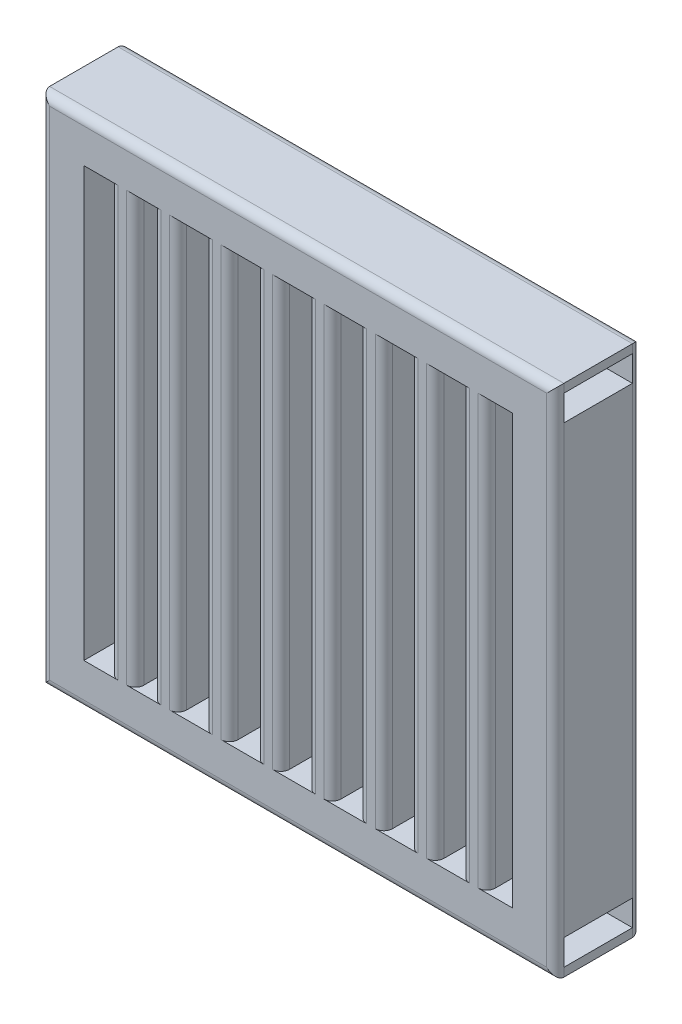
from build123d import *

# Parameters (mm, degrees)
SKETCH1_W           = 152.4
SKETCH1_H           = 152.4
BOSS_EXTRUDE1_DEPTH = 25.4
SKETCH7_W           = 20.32
SKETCH7_H           = 7.62
CUT_EXTRUDE4_DEPTH  = 25.4
SKETCH8_W           = 20.32
SKETCH8_H           = 7.62
CUT_EXTRUDE5_DEPTH  = 25.4
SKETCH9_W           = 7.62
SKETCH9_H           = 127
SKETCH9_W_2         = 5.08
CUT_EXTRUDE6_DEPTH  = 25.4
FILLET3_R           = 2.54
FILLET4_R           = 2.54
FILLET5_DEPTH       = 152.4
FILLET5_START       = -153
FILLET5_2_DEPTH     = 154
FILLET6_R           = 2.54
SKETCH11_W          = 20.32
SKETCH11_H          = 7.62
CUT_EXTRUDE8_DEPTH  = 25.4
SKETCH12_W          = 20.32
SKETCH12_H          = 7.62
CUT_EXTRUDE9_DEPTH  = 25.4


with BuildPart() as part:
    # Sketch1 → Boss-Extrude1 (new body)
    with BuildSketch(Plane.XY):
        with Locations((-76.2, 76.2)):
            Rectangle(SKETCH1_W, SKETCH1_H)
    extrude(amount=BOSS_EXTRUDE1_DEPTH)

    # Sketch7 → Cut-Extrude4 (cut)
    with BuildSketch(Plane(origin=(0, 0, 0), x_dir=(0, 0, -1), z_dir=(1, 0, 0))):
        with Locations((-12.7, 146.05)):
            Rectangle(SKETCH7_W, SKETCH7_H)
    extrude(amount=-CUT_EXTRUDE4_DEPTH, mode=Mode.SUBTRACT)

    # Sketch8 → Cut-Extrude5 (cut)
    with BuildSketch(Plane(origin=(0, 0, 0), x_dir=(0, 0, -1), z_dir=(1, 0, 0))):
        with Locations((-12.7, 6.35)):
            Rectangle(SKETCH8_W, SKETCH8_H)
    extrude(amount=-CUT_EXTRUDE5_DEPTH, mode=Mode.SUBTRACT)

    # Sketch9 → Cut-Extrude6 (cut)
    with BuildSketch(Plane.XY.offset(25.4)):
        with Locations((-135.89, 76.2)):
            Rectangle(SKETCH9_W, SKETCH9_H)
        with Locations((-121.92, 76.2)):
            Rectangle(SKETCH9_W_2, SKETCH9_H)
        with Locations((-107.95, 76.2)):
            Rectangle(SKETCH9_W, SKETCH9_H)
        with Locations((-92.71, 76.2)):
            Rectangle(SKETCH9_W, SKETCH9_H)
        with Locations((-77.47, 76.2)):
            Rectangle(SKETCH9_W, SKETCH9_H)
        with Locations((-62.23, 76.2)):
            Rectangle(SKETCH9_W, SKETCH9_H)
        with Locations((-46.99, 76.2)):
            Rectangle(SKETCH9_W, SKETCH9_H)
        with Locations((-31.75, 76.2)):
            Rectangle(SKETCH9_W, SKETCH9_H)
        with Locations((-16.51, 76.2)):
            Rectangle(SKETCH9_W, SKETCH9_H)
    extrude(amount=-CUT_EXTRUDE6_DEPTH, mode=Mode.SUBTRACT)

    # Fillet3
    fillet3_edges = [part.edges().sort_by_distance(p)[0] for p in [
        (-73.66, 76.2, 25.4),
        (-81.28, 76.2, 25.4),
        (-58.42, 76.2, 25.4),
        (-66.04, 76.2, 25.4),
        (-43.18, 76.2, 25.4),
        (-50.8, 76.2, 25.4),
        (-27.94, 76.2, 25.4),
        (-35.56, 76.2, 25.4),
        (-20.32, 76.2, 25.4),
        (-132.08, 76.2, 25.4),
        (-119.38, 76.2, 25.4),
        (-124.46, 76.2, 25.4),
        (-104.14, 76.2, 25.4),
        (-111.76, 76.2, 25.4),
        (-88.9, 76.2, 25.4),
        (-96.52, 76.2, 25.4),
    ]]
    fillet(fillet3_edges, radius=FILLET3_R)

    # Fillet4
    fillet4_edges = [part.edges().sort_by_distance(p)[0] for p in [
        (-81.28, 76.2, 0),
        (-73.66, 76.2, 0),
        (-66.04, 76.2, 0),
        (-58.42, 76.2, 0),
        (-50.8, 76.2, 0),
        (-43.18, 76.2, 0),
        (-35.56, 76.2, 0),
        (-27.94, 76.2, 0),
        (-20.32, 76.2, 0),
        (-12.7, 76.2, 0),
        (-139.7, 76.2, 0),
        (-132.08, 76.2, 0),
        (-124.46, 76.2, 0),
        (-119.38, 76.2, 0),
        (-111.76, 76.2, 0),
        (-104.14, 76.2, 0),
        (-96.52, 76.2, 0),
        (-88.9, 76.2, 0),
    ]]
    fillet(fillet4_edges, radius=FILLET4_R)

    # Fillet5: read off the stored shape, not the designer's step
    # Fillet5 outline → Fillet5 (cut)
    with BuildSketch(Plane(origin=(0, 0, 0), x_dir=(1, 0, 0), z_dir=(0, 1, 0))):
        with BuildLine():
            Line((-152.4, 0), (-152.4, -2.54))
            ThreePointArc((-152.4, -2.54), (-151.656051224, -0.743948776), (-149.86, 0))
            Line((-149.86, 0), (-152.4, 0))
        make_face()
        with BuildLine():
            Line((0, 0), (-2.54, 0))
            ThreePointArc((-2.54, 0), (-0.743948776, -0.743948776), (0, -2.54))
            Line((0, -2.54), (0, 0))
        make_face()
    extrude(amount=FILLET5_DEPTH, mode=Mode.SUBTRACT)

    # Fillet5 2 outline → Fillet5 2 (cut)
    with BuildSketch(Plane.YZ.offset(FILLET5_START)):
        with BuildLine():
            ThreePointArc((152.4, 2.54), (151.656051224, 0.743948776), (149.86, 0))
            Line((149.86, 0), (152.4, 0))
            Line((152.4, 0), (152.4, 2.54))
        make_face()
        with BuildLine():
            ThreePointArc((2.54, 0), (0.743948776, 0.743948776), (0, 2.54))
            Line((0, 2.54), (0, 0))
            Line((0, 0), (2.54, 0))
        make_face()
    extrude(amount=FILLET5_2_DEPTH, mode=Mode.SUBTRACT)

    # Fillet6
    fillet6_edges = [part.edges().sort_by_distance(p)[0] for p in [
        (-152.4, 76.2, 25.4),
        (-76.2, 0, 25.4),
        (0, 76.2, 25.4),
        (-76.2, 152.4, 25.4),
    ]]
    fillet(fillet6_edges, radius=FILLET6_R - 0.0001)  # a hair under: the kernel refuses the full size

    # Sketch11 → Cut-Extrude8 (cut)
    with BuildSketch(Plane.ZY.offset(152.4)):
        with Locations((12.7, 146.05)):
            Rectangle(SKETCH11_W, SKETCH11_H)
    extrude(amount=-CUT_EXTRUDE8_DEPTH, mode=Mode.SUBTRACT)

    # Sketch12 → Cut-Extrude9 (cut)
    with BuildSketch(Plane.ZY.offset(152.4)):
        with Locations((12.7, 6.35)):
            Rectangle(SKETCH12_W, SKETCH12_H)
    extrude(amount=-CUT_EXTRUDE9_DEPTH, mode=Mode.SUBTRACT)


solid = part.part
